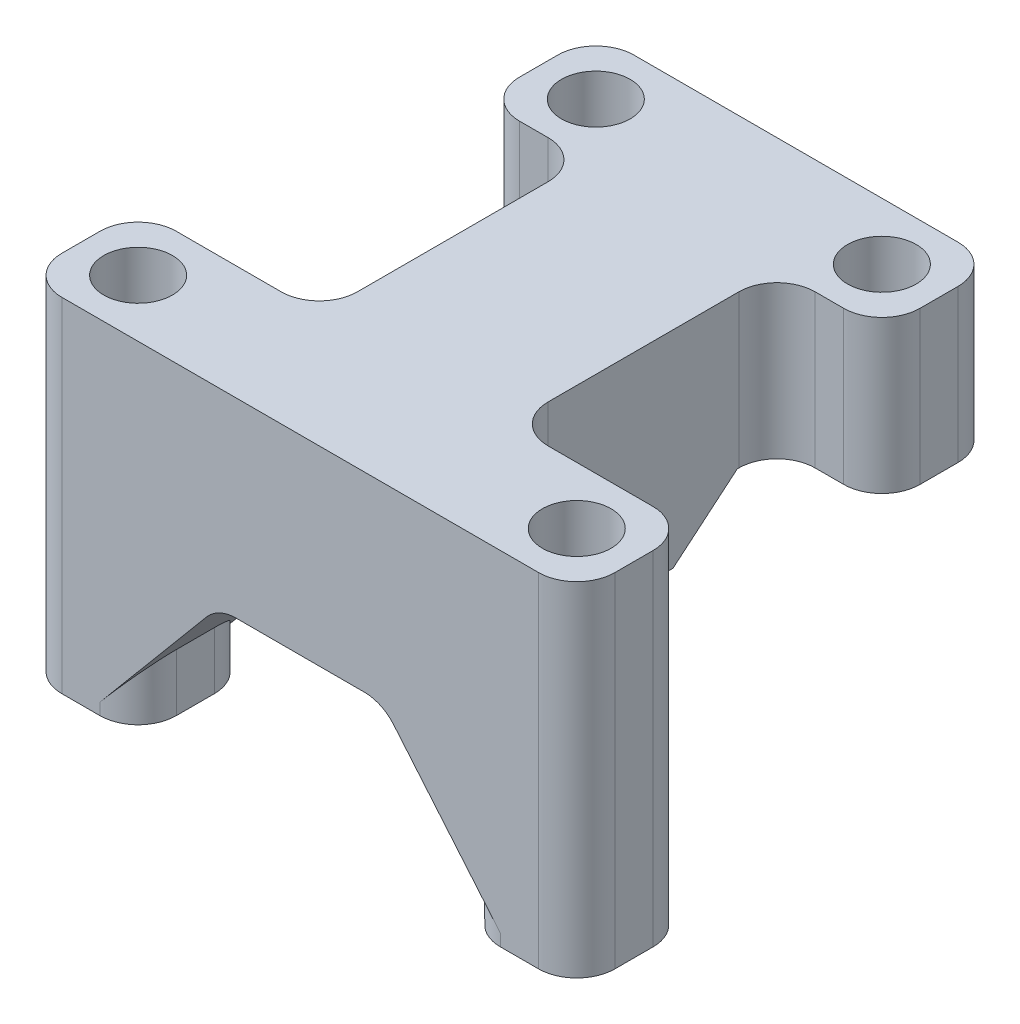
from build123d import *
from OCP.BRepFilletAPI import BRepFilletAPI_MakeChamfer

# Parameters (mm, degrees)
SKETCH2_R           = 1.8
BOSS_EXTRUDE1_DEPTH = 10
CHAMFER1_SIZE       = 20
CHAMFER1_SIZE_2     = 16.781992624
BOSS_EXTRUDE3_START = 8
SKETCH4_R           = 1.8
BOSS_EXTRUDE3_DEPTH = 8
CUT_EXTRUDE1_DEPTH  = 8
CHAMFER3_SIZE       = 5
CHAMFER3_SIZE2      = 4.195498156
FILLET1_R           = 2


with BuildPart() as part:
    # Sketch2 → Boss-Extrude1 (new body)
    with BuildSketch(Plane(origin=(0, 0, 0), x_dir=(1, 0, 0), z_dir=(0, 1, 0))):
        Polygon((-11.5, 3), (-5, 3), (-5, 17), (-7.5, 17), (-10.5, 17), (-10.5, 23), (-7.5, 23), (7.5, 23), (10.5, 23), (10.5, 17), (7.5, 17), (5, 17), (5, 3), (11.5, 3), (14.5, 3), (14.5, -3), (11.5, -3), (-11.5, -3), (-14.5, -3), (-14.5, 3), align=None)
        with Locations(Location((-11.5, 0, 0), (0, 0, 270))):
            Circle(SKETCH2_R, mode=Mode.SUBTRACT)
        with Locations(Location((11.5, 0, 0), (0, 0, 270))):
            Circle(SKETCH2_R, mode=Mode.SUBTRACT)
        with Locations(Location((-7.5, 20, 0), (0, 0, 270))):
            Circle(SKETCH2_R, mode=Mode.SUBTRACT)
        with Locations(Location((7.5, 20, 0), (0, 0, 270))):
            Circle(SKETCH2_R, mode=Mode.SUBTRACT)
    extrude(amount=-BOSS_EXTRUDE1_DEPTH)

    # Chamfer1
    # the kernel refuses this chamfer: 20, 16.781992624 mm, written as the material it takes off along each edge
    with BuildSketch(Plane(origin=(62.048122067, -10, -23), x_dir=(0, -0.02493932209023439, 0.9996889667359941), z_dir=(-1, 0, 0))) as chamfer1_piece_1:
        Polygon((CHAMFER1_SIZE * 0.999688966736, CHAMFER1_SIZE * 0.0249393220902), (-CHAMFER1_SIZE_2 * 0.0249393220896, CHAMFER1_SIZE_2 * 0.999688966709), (0, 0), align=None)
    extrude(amount=124.096244134, mode=Mode.SUBTRACT)

    # Sketch4 → Boss-Extrude3 (add)
    with BuildSketch(Plane(origin=(0, 0, 0), x_dir=(1, 0, 0), z_dir=(0, 1, 0)).offset(BOSS_EXTRUDE3_START)):
        Polygon((-7.5, 23), (7.5, 23), (10.5, 23), (10.5, 17), (7.5, 17), (5, 17), (5, 3), (11.5, 3), (14.5, 3), (14.5, -3), (11.5, -3), (-11.5, -3), (-14.5, -3), (-14.5, 3), (-11.5, 3), (-5, 3), (-5, 17), (-7.5, 17), (-10.5, 17), (-10.5, 23), align=None)
        with Locations(Location((-11.5, 0, 0), (0, 0, 270))):
            Circle(SKETCH4_R, mode=Mode.SUBTRACT)
        with Locations(Location((11.5, 0, 0), (0, 0, 270))):
            Circle(SKETCH4_R, mode=Mode.SUBTRACT)
        with Locations(Location((7.5, 20, 0), (0, 0, 270))):
            Circle(SKETCH4_R, mode=Mode.SUBTRACT)
        with Locations(Location((-7.5, 20, 0), (0, 0, 270))):
            Circle(SKETCH4_R, mode=Mode.SUBTRACT)
    extrude(amount=-BOSS_EXTRUDE3_DEPTH)

    # Sketch5 → Cut-Extrude1 (cut)
    with BuildSketch(Plane.XZ.offset(10)):
        Polygon((-8.5, 3), (8.5, 3), (8.5, -3), (8.5, -14.917535926), (5, -14.917535926), (-5, -14.917535926), (-8.5, -14.917535926), (-8.5, -3), align=None)
    extrude(amount=-CUT_EXTRUDE1_DEPTH, mode=Mode.SUBTRACT)

    # Chamfer3: one chamfer whose edges measure the first distance from different faces: ONE call of the kernel's chamfer builder (chamfer() names one face for all edges)
    chamfer3_edges_1 = [part.edges().sort_by_distance(p)[0] for p in [
        (8.5, -2, 0),
    ]]
    chamfer3_side_1 = [part.faces().sort_by_distance(p)[0] for p in [
        (8.5, -6, 0),
    ]]
    chamfer3_edges_2 = [part.edges().sort_by_distance(p)[0] for p in [
        (-8.5, -2, 0),
    ]]
    chamfer3_side_2 = [part.faces().sort_by_distance(p)[0] for p in [
        (-8.5, -6, 0),
    ]]
    chamfer3 = BRepFilletAPI_MakeChamfer(part.part.solid().wrapped)
    for e in chamfer3_edges_1:
        chamfer3.Add(CHAMFER3_SIZE, CHAMFER3_SIZE2, e.wrapped, chamfer3_side_1[0].wrapped)  # the first distance lies on this face
    for e in chamfer3_edges_2:
        chamfer3.Add(CHAMFER3_SIZE, CHAMFER3_SIZE2, e.wrapped, chamfer3_side_2[0].wrapped)  # the first distance lies on this face
    add(Compound.cast(chamfer3.Shape()), mode=Mode.REPLACE)

    # Fillet1
    fillet1_edges = [part.edges().sort_by_distance(p)[0] for p in [
        (-10.5, 4, -23),
        (-10.5, 4, -17),
        (-5, 4, -17),
        (5, 4, -17),
        (10.5, 4, -17),
        (10.5, 4, -23),
        (5, 2.585568787, -3),
        (-5, 2.585568787, -3),
        (-8.5, -8.5, -3),
        (-4.304501844, -2, -4.76701437),
        (4.304501844, -2, -4.76701437),
        (8.5, -8.5, -3),
        (8.5, -8.5, 3),
        (-8.5, -8.5, 3),
        (14.5, -1, -3),
        (14.5, -1, 3),
        (-14.5, -1, 3),
        (-14.5, -1, -3),
    ]]
    fillet(fillet1_edges, radius=FILLET1_R)


solid = part.part
